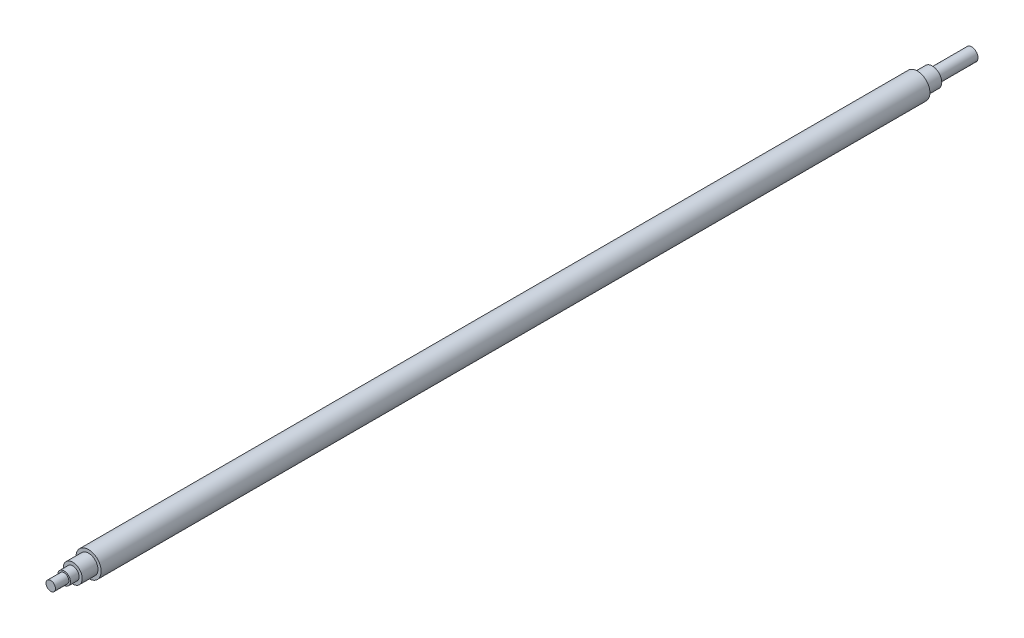
from build123d import *


with BuildPart() as part:
    # Schizzo2 → Rivoluzione2 (revolve)
    with BuildSketch(Plane(origin=(0, 0, 0), x_dir=(0, 0, -1), z_dir=(1, 0, 0))):
        Polygon((8.5, 0), (8.5, 3), (17, 3), (17, 4), (22.5, 4), (22.5, 6), (32.5, 6), (32.5, 8), (558.5, 8), (558.5, 6), (568, 6), (568, 4), (593, 4), (593, 0), align=None)
    revolve(axis=Axis((0, 0, 0), (0, 0, -1)))


solid = part.part
